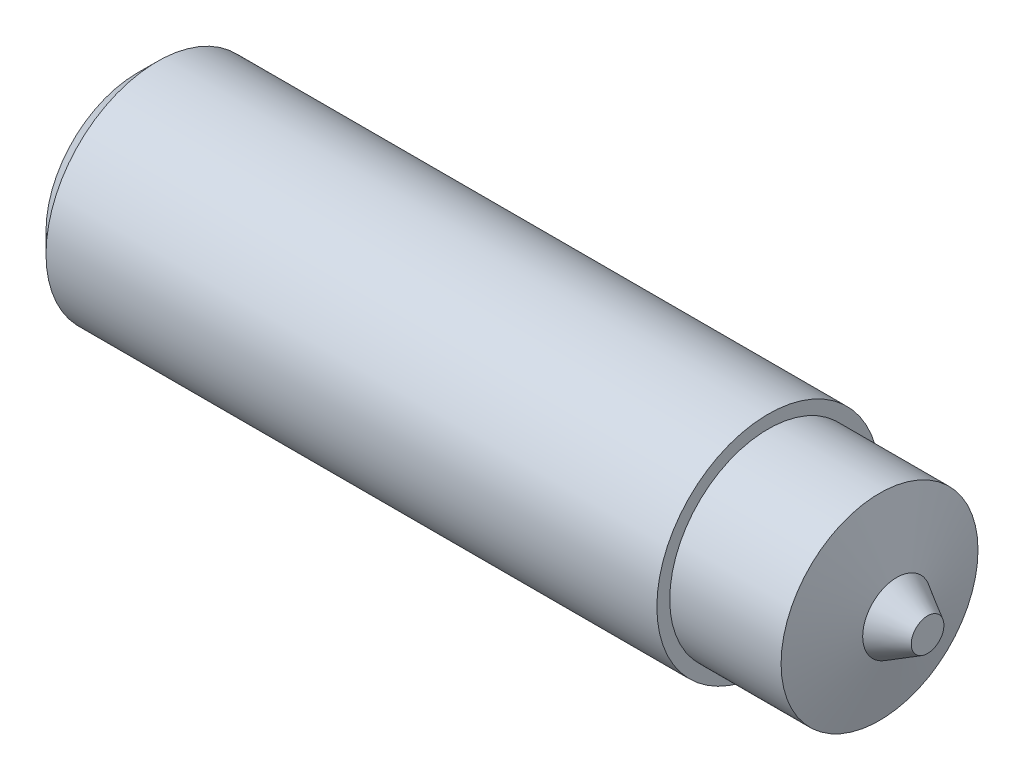
from build123d import *

# Parameters (mm, degrees)
HEADCHAMFER_SIZE = 0.5415


with BuildPart() as part:
    # Sketch1 → Base (revolve)
    with BuildSketch(Plane.XY):
        Polygon((0, 0), (0, 3), (17, 3), (17, 2.652751055), (20, 2.652751055), (20.464503411, 0.919200723), (21.294503411, 0.44), (21.294503411, 0), align=None)
    revolve(axis=Axis((-13.950889193, 0, 0), (1, 0, 0)))

    # HeadChamfer
    headchamfer_edges = [part.edges().sort_by_distance(p)[0] for p in [
        (0, -3, 0),
    ]]
    chamfer(headchamfer_edges, length=HEADCHAMFER_SIZE)


solid = part.part
